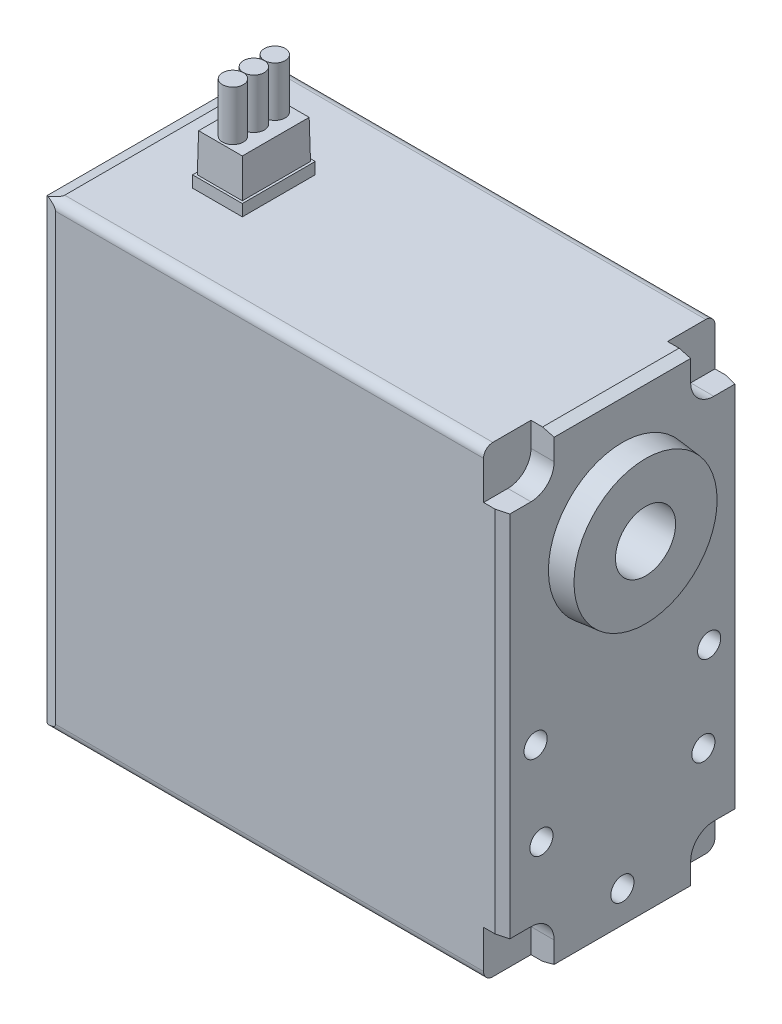
from build123d import *
from OCP.BRepFilletAPI import BRepFilletAPI_MakeChamfer

# Parameters (mm, degrees)
SKETCH_1_W            = 40
SKETCH_1_H            = 20
EXTRUDE_1_DEPTH       = 20
SKETCH_4_R            = 6.5
EXTRUDE_2_DEPTH       = 2
CHAMFER_1_SIZE        = 3
CHAMFER_1_SIZE_2      = 0.315312706
SKETCH_5_R            = 6.5
EXTRUDE_3_DEPTH       = 2
CHAMFER_3_SIZE        = 3
CHAMFER_3_SIZE_2      = 0.315312706
SKETCH_7_R            = 2.6
CUT_EXTRUDE_1_DEPTH   = 10
SKETCH_8_R            = 3
EXTRUDE_4_DEPTH       = 4
SKETCH_8_5_R          = 3.45
SKETCH_8_5_R_2        = 3
EXTRUDE_5_DEPTH       = 0.2
SKETCH_8_6_R          = 3.75
SKETCH_8_6_R_2        = 3.45
EXTRUDE_6_DEPTH       = 0.1
SKETCH_9_R            = 1.5
CUT_EXTRUDE_2_DEPTH   = 5
CHAMFER_4_SIZE        = 1
CHAMFER_4_SIZE2       = 0.267949192
CHAMFER_5_SIZE        = 1
CHAMFER_5_SIZE2       = 0.267949192
FILLET_2_R            = 0.8
SKETCH_10_W           = 4.3
SKETCH_10_H           = 6.3
EXTRUDE_7_DEPTH       = 1
SKETCH_10_3_W         = 3.9
SKETCH_10_3_H         = 5.9
EXTRUDE_8_DEPTH       = 4.3
CHAMFER_6_SIZE        = 3.5
CHAMFER_6_SIZE_2      = 0.061092727
SKETCH_11_R           = 0.9
EXTRUDE_10_DEPTH      = 4.3
SKETCH_12_R           = 1
CUT_EXTRUDE_3_DEPTH   = 4
CUT_EXTRUDE_START     = -4
SKETCH_13_R           = 1
CUT_EXTRUDE_4_DEPTH   = 4
CUT_EXTRUDE_5_DEPTH   = 2
MIRROR_3_COPY_1_DEPTH = 2
SKETCH_15_R           = 1
CUT_EXTRUDE_7_DEPTH   = 4


with BuildPart() as part:
    # 草图1 → 凸台-拉伸1 (new, symmetric)
    with BuildSketch(Plane(origin=(0, 0, 0), x_dir=(1, 0, 0), z_dir=(0, 1, 0))):
        Rectangle(SKETCH_1_W, SKETCH_1_H)
    extrude(amount=EXTRUDE_1_DEPTH, both=True)

    # 草图4 → 凸台-拉伸2 (add)
    with BuildSketch(Plane.ZY.offset(20)):
        with Locations(Location((0, 10, 0), (0, 0, 180))):
            Circle(SKETCH_4_R)
    extrude(amount=EXTRUDE_2_DEPTH)

    # 倒角1
    # the kernel refuses this chamfer: 3, 0.315312706 mm, written as the material it takes off along each edge
    with BuildSketch(Plane(origin=(-22, 10, 0), x_dir=(0, 0, -1), z_dir=(0, 1, 0))) as chamfer_1_piece_1_section:
        Polygon((6.5, -CHAMFER_1_SIZE), (6.5 - CHAMFER_1_SIZE_2, 0), (6.5, 0), align=None)
    chamfer_1_piece_1 = revolve(axis=Axis((-22, 10, 0), (-1, 0, 0)), mode=Mode.PRIVATE)
    chamfer_1_piece_1 = split(chamfer_1_piece_1, bisect_by=Plane(origin=(-20, 10, 6.31172405), z_dir=(-1, 0, 0)), keep=Keep.TOP, mode=Mode.PRIVATE)
    add(chamfer_1_piece_1, mode=Mode.SUBTRACT)

    # 草图5 → 凸台-拉伸3 (add)
    with BuildSketch(Plane(origin=(20, 0, 0), x_dir=(0, 0, -1), z_dir=(1, 0, 0))):
        with Locations(Location((0, 10, 0), (0, 0, 180))):
            Circle(SKETCH_5_R)
    extrude(amount=EXTRUDE_3_DEPTH)

    # 倒角3
    # the kernel refuses this chamfer: 3, 0.315312706 mm, written as the material it takes off along each edge
    with BuildSketch(Plane(origin=(22, 10, 0), x_dir=(0, 0, 1), z_dir=(0, 1, 0))) as chamfer_3_piece_1_section:
        Polygon((6.5, -CHAMFER_3_SIZE), (6.5 - CHAMFER_3_SIZE_2, 0), (6.5, 0), align=None)
    chamfer_3_piece_1 = revolve(axis=Axis((22, 10, 0), (1, 0, 0)), mode=Mode.PRIVATE)
    chamfer_3_piece_1 = split(chamfer_3_piece_1, bisect_by=Plane(origin=(20, 10, -6.31172405), z_dir=(1, 0, 0)), keep=Keep.TOP, mode=Mode.PRIVATE)
    add(chamfer_3_piece_1, mode=Mode.SUBTRACT)

    # 草图7 → 切除-拉伸1 (cut)
    with BuildSketch(Plane(origin=(22, 0, 0), x_dir=(0, 0, -1), z_dir=(1, 0, 0))):
        with Locations((0, 10)):
            Circle(SKETCH_7_R)
    extrude(amount=-CUT_EXTRUDE_1_DEPTH, mode=Mode.SUBTRACT)

    # 草图8 → 凸台-拉伸4 (add)
    with BuildSketch(Plane.ZY.offset(22)):
        with Locations((0, 10)):
            Circle(SKETCH_8_R)
    extrude(amount=EXTRUDE_4_DEPTH)

    # 草图8<5> → 凸台-拉伸5 (add)
    with BuildSketch(Plane.ZY.offset(22)):
        with Locations((0, 10)):
            Circle(SKETCH_8_5_R)
        with Locations((0, 10)):
            Circle(SKETCH_8_5_R_2, mode=Mode.SUBTRACT)
    extrude(amount=EXTRUDE_5_DEPTH)

    # 草图8<6> → 凸台-拉伸6 (add)
    with BuildSketch(Plane.ZY.offset(22)):
        with Locations((0, 10)):
            Circle(SKETCH_8_6_R)
        with Locations((0, 10)):
            Circle(SKETCH_8_6_R_2, mode=Mode.SUBTRACT)
    extrude(amount=EXTRUDE_6_DEPTH)

    # 草图9 → 切除-拉伸2 (cut)
    with BuildSketch(Plane.ZY.offset(26)):
        with Locations((0, 10)):
            Circle(SKETCH_9_R)
    extrude(amount=-CUT_EXTRUDE_2_DEPTH, mode=Mode.SUBTRACT)

    # 倒角4: one chamfer whose edges measure the first distance from different faces: ONE call of the kernel's chamfer builder (chamfer() names one face for all edges)
    chamfer_4_edges_1 = [part.edges().sort_by_distance(p)[0] for p in [
        (20, 20, 0),
    ]]
    chamfer_4_side_1 = [part.faces().sort_by_distance(p)[0] for p in [
        (0, 20, 0),
    ]]
    chamfer_4_edges_2 = [part.edges().sort_by_distance(p)[0] for p in [
        (20, -20, 0),
    ]]
    chamfer_4_side_2 = [part.faces().sort_by_distance(p)[0] for p in [
        (0, -20, 0),
    ]]
    chamfer_4_edges_3 = [part.edges().sort_by_distance(p)[0] for p in [
        (20, 0, 10),
    ]]
    chamfer_4_side_3 = [part.faces().sort_by_distance(p)[0] for p in [
        (0, 0, 10),
    ]]
    chamfer_4_edges_4 = [part.edges().sort_by_distance(p)[0] for p in [
        (20, 0, -10),
    ]]
    chamfer_4_side_4 = [part.faces().sort_by_distance(p)[0] for p in [
        (0, 0, -10),
    ]]
    chamfer_4 = BRepFilletAPI_MakeChamfer(part.part.solid().wrapped)
    for e in chamfer_4_edges_1:
        chamfer_4.Add(CHAMFER_4_SIZE, CHAMFER_4_SIZE2, e.wrapped, chamfer_4_side_1[0].wrapped)  # the first distance lies on this face
    for e in chamfer_4_edges_2:
        chamfer_4.Add(CHAMFER_4_SIZE, CHAMFER_4_SIZE2, e.wrapped, chamfer_4_side_2[0].wrapped)  # the first distance lies on this face
    for e in chamfer_4_edges_3:
        chamfer_4.Add(CHAMFER_4_SIZE, CHAMFER_4_SIZE2, e.wrapped, chamfer_4_side_3[0].wrapped)  # the first distance lies on this face
    for e in chamfer_4_edges_4:
        chamfer_4.Add(CHAMFER_4_SIZE, CHAMFER_4_SIZE2, e.wrapped, chamfer_4_side_4[0].wrapped)  # the first distance lies on this face
    add(Compound.cast(chamfer_4.Shape()), mode=Mode.REPLACE)

    # 倒角5: one chamfer whose edges measure the first distance from different faces: ONE call of the kernel's chamfer builder (chamfer() names one face for all edges)
    chamfer_5_edges_1 = [part.edges().sort_by_distance(p)[0] for p in [
        (-20, 20, 0),
    ]]
    chamfer_5_side_1 = [part.faces().sort_by_distance(p)[0] for p in [
        (-0.5, 20, 0),
    ]]
    chamfer_5_edges_2 = [part.edges().sort_by_distance(p)[0] for p in [
        (-20, -20, 0),
    ]]
    chamfer_5_side_2 = [part.faces().sort_by_distance(p)[0] for p in [
        (-0.5, -20, 0),
    ]]
    chamfer_5_edges_3 = [part.edges().sort_by_distance(p)[0] for p in [
        (-20, 0, 10),
    ]]
    chamfer_5_side_3 = [part.faces().sort_by_distance(p)[0] for p in [
        (-0.5, 0, 10),
    ]]
    chamfer_5_edges_4 = [part.edges().sort_by_distance(p)[0] for p in [
        (-20, 0, -10),
    ]]
    chamfer_5_side_4 = [part.faces().sort_by_distance(p)[0] for p in [
        (-0.5, 0, -10),
    ]]
    chamfer_5 = BRepFilletAPI_MakeChamfer(part.part.solid().wrapped)
    for e in chamfer_5_edges_1:
        chamfer_5.Add(CHAMFER_5_SIZE, CHAMFER_5_SIZE2, e.wrapped, chamfer_5_side_1[0].wrapped)  # the first distance lies on this face
    for e in chamfer_5_edges_2:
        chamfer_5.Add(CHAMFER_5_SIZE, CHAMFER_5_SIZE2, e.wrapped, chamfer_5_side_2[0].wrapped)  # the first distance lies on this face
    for e in chamfer_5_edges_3:
        chamfer_5.Add(CHAMFER_5_SIZE, CHAMFER_5_SIZE2, e.wrapped, chamfer_5_side_3[0].wrapped)  # the first distance lies on this face
    for e in chamfer_5_edges_4:
        chamfer_5.Add(CHAMFER_5_SIZE, CHAMFER_5_SIZE2, e.wrapped, chamfer_5_side_4[0].wrapped)  # the first distance lies on this face
    add(Compound.cast(chamfer_5.Shape()), mode=Mode.REPLACE)

    # 圆角2
    fillet_2_edges = [part.edges().sort_by_distance(p)[0] for p in [
        (0, -20, -10),
        (0, 20, -10),
        (0, -20, 10),
        (0, 20, 10),
    ]]
    fillet(fillet_2_edges, radius=FILLET_2_R)

    # 草图10 → 凸台-拉伸7 (add)
    with BuildSketch(Plane(origin=(0, 20, 0), x_dir=(1, 0, 0), z_dir=(0, 1, 0))):
        with Locations((-11.85, 0)):
            Rectangle(SKETCH_10_W, SKETCH_10_H)
    extrude(amount=EXTRUDE_7_DEPTH)

    # 草图10<3> → 凸台-拉伸8 (add)
    with BuildSketch(Plane(origin=(0, 20, 0), x_dir=(1, 0, 0), z_dir=(0, 1, 0))):
        with Locations((-11.85, 0)):
            Rectangle(SKETCH_10_3_W, SKETCH_10_3_H)
    extrude(amount=EXTRUDE_8_DEPTH)

    # 倒角6
    # the kernel refuses this chamfer: 3.5, 0.061092727 mm, written as the material it takes off along each edge
    with BuildSketch(Plane(origin=(-9.9, 24.3, -12.049948743), x_dir=(0.0006712501823119154, -0.999999774711571, 0), z_dir=(0, 0, 1))) as chamfer_6_piece_1_section:
        Polygon((CHAMFER_6_SIZE * 0.999999774712, -CHAMFER_6_SIZE * 0.000671250182312), (-CHAMFER_6_SIZE_2 * 0.000671250185045, -CHAMFER_6_SIZE_2 * 0.999999778783), (0, 0), align=None)
    chamfer_6_piece_1 = extrude(amount=24.099897487, mode=Mode.PRIVATE)
    chamfer_6_piece_1 = split(chamfer_6_piece_1, bisect_by=Plane(origin=(-9.882223513, 21, 0), z_dir=(0, 1, 0)), keep=Keep.TOP, mode=Mode.PRIVATE)
    add(chamfer_6_piece_1, mode=Mode.SUBTRACT)
    with BuildSketch(Plane(origin=(-22.899948743, 24.3, -2.95), x_dir=(0, -0.999999774711571, -0.0006712501823120375), z_dir=(1, 0, 0))) as chamfer_6_piece_2_section:
        Polygon((CHAMFER_6_SIZE * 0.999999774712, -CHAMFER_6_SIZE * 0.000671250182312), (-CHAMFER_6_SIZE_2 * 0.000671250185045, -CHAMFER_6_SIZE_2 * 0.999999778783), (0, 0), align=None)
    chamfer_6_piece_2 = extrude(amount=22.099897487, mode=Mode.PRIVATE)
    chamfer_6_piece_2 = split(chamfer_6_piece_2, bisect_by=Plane(origin=(-11.85, 21, -2.967776487), z_dir=(0, 1, 0)), keep=Keep.TOP, mode=Mode.PRIVATE)
    add(chamfer_6_piece_2, mode=Mode.SUBTRACT)
    with BuildSketch(Plane(origin=(-13.8, 24.3, 12.049948743), x_dir=(-0.0006712501823119154, -0.999999774711571, 0), z_dir=(0, 0, -1))) as chamfer_6_piece_3_section:
        Polygon((CHAMFER_6_SIZE * 0.999999774712, -CHAMFER_6_SIZE * 0.000671250182312), (-CHAMFER_6_SIZE_2 * 0.000671250185045, -CHAMFER_6_SIZE_2 * 0.999999778783), (0, 0), align=None)
    chamfer_6_piece_3 = extrude(amount=24.099897487, mode=Mode.PRIVATE)
    chamfer_6_piece_3 = split(chamfer_6_piece_3, bisect_by=Plane(origin=(-13.817776487, 21, 0), z_dir=(0, 1, 0)), keep=Keep.TOP, mode=Mode.PRIVATE)
    add(chamfer_6_piece_3, mode=Mode.SUBTRACT)
    with BuildSketch(Plane(origin=(-0.800051257, 24.3, 2.95), x_dir=(0, -0.999999774711571, 0.0006712501823120375), z_dir=(-1, 0, 0))) as chamfer_6_piece_4_section:
        Polygon((CHAMFER_6_SIZE * 0.999999774712, -CHAMFER_6_SIZE * 0.000671250182312), (-CHAMFER_6_SIZE_2 * 0.000671250185045, -CHAMFER_6_SIZE_2 * 0.999999778783), (0, 0), align=None)
    chamfer_6_piece_4 = extrude(amount=22.099897487, mode=Mode.PRIVATE)
    chamfer_6_piece_4 = split(chamfer_6_piece_4, bisect_by=Plane(origin=(-11.85, 21, 2.967776487), z_dir=(0, 1, 0)), keep=Keep.TOP, mode=Mode.PRIVATE)
    add(chamfer_6_piece_4, mode=Mode.SUBTRACT)

    # 草图11 → 凸台-拉伸10 (add)
    with BuildSketch(Plane(origin=(0, 24.3, 0), x_dir=(1, 0, 0), z_dir=(0, 1, 0))):
        with Locations(Location((-11.85, 0, 0), (0, 0, 90))):
            Circle(SKETCH_11_R)
        with Locations(Location((-11.85, 1.81, 0), (0, 0, 90))):
            Circle(SKETCH_11_R)
        with Locations(Location((-11.85, -1.81, 0), (0, 0, 90))):
            Circle(SKETCH_11_R)
    extrude(amount=EXTRUDE_10_DEPTH)

    # 草图12 → 切除-拉伸3 (cut)
    with BuildSketch(Plane(origin=(20, 0, 0), x_dir=(0, 0, -1), z_dir=(1, 0, 0))):
        with Locations((-7.5, -2.5)):
            Circle(SKETCH_12_R)
        with Locations(Location((7.5, -2.5, 0), (0, 0, 180))):
            Circle(SKETCH_12_R)
    extrude(amount=-CUT_EXTRUDE_3_DEPTH, mode=Mode.SUBTRACT)

    # 草图13 → 切除-拉伸4 (cut)
    with BuildSketch(Plane.ZY.offset(20).offset(CUT_EXTRUDE_START)):
        with Locations((-7.5, -17.5)):
            Circle(SKETCH_13_R)
        with Locations(Location((7.5, -17.5, 0), (0, 0, 180))):
            Circle(SKETCH_13_R)
        with Locations((-7.5, -2.5)):
            Circle(SKETCH_13_R)
        with Locations((-7.5, 17.5)):
            Circle(SKETCH_13_R)
        with Locations(Location((7.5, 17.5, 0), (0, 0, 180))):
            Circle(SKETCH_13_R)
        with Locations(Location((7.5, -2.5, 0), (0, 0, 180))):
            Circle(SKETCH_13_R)
    extrude(amount=CUT_EXTRUDE_4_DEPTH, mode=Mode.SUBTRACT)

    # 草图14 → 切除-拉伸5 (cut)
    with BuildSketch(Plane(origin=(20, 0, 0), x_dir=(0, 0, -1), z_dir=(1, 0, 0))):
        with BuildLine():
            ThreePointArc((-9.732050808, 17.097759488), (-8.994421988, 16.2260106), (-7.9, 15.9))
            ThreePointArc((-7.9, 15.9), (-6.485786438, 16.485786438), (-5.9, 17.9))
            ThreePointArc((-5.9, 17.9), (-6.2260106, 18.994421988), (-7.097759488, 19.732050808))
            Line((-7.097759488, 19.732050808), (-8.702240512, 19.732050808))
            ThreePointArc((-8.702240512, 19.732050808), (-9.314213562, 19.314213562), (-9.732050808, 18.702240512))
            Line((-9.732050808, 18.702240512), (-9.732050808, 17.097759488))
        make_face()
        with BuildLine():
            Line((-9.732050808, 19.732050808), (-9.732050808, 18.702240512))
            ThreePointArc((-9.732050808, 18.702240512), (-9.314213562, 19.314213562), (-8.702240512, 19.732050808))
            Line((-8.702240512, 19.732050808), (-9.732050808, 19.732050808))
        make_face()
        with BuildLine():
            ThreePointArc((-7.097759488, 19.732050808), (-6.2260106, 18.994421988), (-5.9, 17.9))
            Line((-5.9, 17.9), (-5.9, 19.732050808))
            Line((-5.9, 19.732050808), (-7.097759488, 19.732050808))
        make_face()
        with BuildLine():
            Line((-8.702240512, 19.732050808), (-7.097759488, 19.732050808))
            ThreePointArc((-7.097759488, 19.732050808), (-7.9, 19.9), (-8.702240512, 19.732050808))
        make_face()
        with BuildLine():
            Line((-10, 15.9), (-9.732050808, 15.9))
            Line((-9.732050808, 15.9), (-9.732050808, 17.097759488))
            ThreePointArc((-9.732050808, 17.097759488), (-9.9, 17.9), (-9.732050808, 18.702240512))
            Line((-9.732050808, 18.702240512), (-9.732050808, 19.732050808))
            Line((-9.732050808, 19.732050808), (-8.702240512, 19.732050808))
            ThreePointArc((-8.702240512, 19.732050808), (-7.9, 19.9), (-7.097759488, 19.732050808))
            Line((-7.097759488, 19.732050808), (-5.9, 19.732050808))
            Line((-5.9, 19.732050808), (-5.9, 20))
            Line((-5.9, 20), (-10, 20))
            Line((-10, 20), (-10, 15.9))
        make_face()
        with BuildLine():
            ThreePointArc((-9.732050808, 18.702240512), (-9.9, 17.9), (-9.732050808, 17.097759488))
            Line((-9.732050808, 17.097759488), (-9.732050808, 18.702240512))
        make_face()
        with BuildLine():
            Line((-9.732050808, 15.9), (-7.9, 15.9))
            ThreePointArc((-7.9, 15.9), (-8.994421988, 16.2260106), (-9.732050808, 17.097759488))
            Line((-9.732050808, 17.097759488), (-9.732050808, 15.9))
        make_face()
    cut_extrude_5 = extrude(amount=-CUT_EXTRUDE_5_DEPTH, mode=Mode.SUBTRACT)

    # 镜向2: 切除-拉伸5 across plane
    add(cut_extrude_5.mirror(Plane.ZX), mode=Mode.SUBTRACT)

    # 镜向3: 切除-拉伸5 across plane
    add(cut_extrude_5.mirror(Plane.XY), mode=Mode.SUBTRACT)

    # 镜向3 copy 1 sketch → 镜向3 copy 1 (cut)
    with BuildSketch(Plane(origin=(20, 0, 0), x_dir=(0, 0, 1), z_dir=(1, 0, 0))):
        with BuildLine():
            ThreePointArc((-9.732050808, 17.097759488), (-8.994421988, 16.2260106), (-7.9, 15.9))
            ThreePointArc((-7.9, 15.9), (-6.485786438, 16.485786438), (-5.9, 17.9))
            ThreePointArc((-5.9, 17.9), (-6.2260106, 18.994421988), (-7.097759488, 19.732050808))
            Line((-7.097759488, 19.732050808), (-8.702240512, 19.732050808))
            ThreePointArc((-8.702240512, 19.732050808), (-9.314213562, 19.314213562), (-9.732050808, 18.702240512))
            Line((-9.732050808, 18.702240512), (-9.732050808, 17.097759488))
        make_face()
        with BuildLine():
            Line((-9.732050808, 19.732050808), (-9.732050808, 18.702240512))
            ThreePointArc((-9.732050808, 18.702240512), (-9.314213562, 19.314213562), (-8.702240512, 19.732050808))
            Line((-8.702240512, 19.732050808), (-9.732050808, 19.732050808))
        make_face()
        with BuildLine():
            ThreePointArc((-7.097759488, 19.732050808), (-6.2260106, 18.994421988), (-5.9, 17.9))
            Line((-5.9, 17.9), (-5.9, 19.732050808))
            Line((-5.9, 19.732050808), (-7.097759488, 19.732050808))
        make_face()
        with BuildLine():
            Line((-8.702240512, 19.732050808), (-7.097759488, 19.732050808))
            ThreePointArc((-7.097759488, 19.732050808), (-7.9, 19.9), (-8.702240512, 19.732050808))
        make_face()
        with BuildLine():
            Line((-10, 15.9), (-9.732050808, 15.9))
            Line((-9.732050808, 15.9), (-9.732050808, 17.097759488))
            ThreePointArc((-9.732050808, 17.097759488), (-9.9, 17.9), (-9.732050808, 18.702240512))
            Line((-9.732050808, 18.702240512), (-9.732050808, 19.732050808))
            Line((-9.732050808, 19.732050808), (-8.702240512, 19.732050808))
            ThreePointArc((-8.702240512, 19.732050808), (-7.9, 19.9), (-7.097759488, 19.732050808))
            Line((-7.097759488, 19.732050808), (-5.9, 19.732050808))
            Line((-5.9, 19.732050808), (-5.9, 20))
            Line((-5.9, 20), (-10, 20))
            Line((-10, 20), (-10, 15.9))
        make_face()
        with BuildLine():
            ThreePointArc((-9.732050808, 18.702240512), (-9.9, 17.9), (-9.732050808, 17.097759488))
            Line((-9.732050808, 17.097759488), (-9.732050808, 18.702240512))
        make_face()
        with BuildLine():
            Line((-9.732050808, 15.9), (-7.9, 15.9))
            ThreePointArc((-7.9, 15.9), (-8.994421988, 16.2260106), (-9.732050808, 17.097759488))
            Line((-9.732050808, 17.097759488), (-9.732050808, 15.9))
        make_face()
    extrude(amount=-MIRROR_3_COPY_1_DEPTH, mode=Mode.SUBTRACT)

    # 草图15 → 切除-拉伸7 (cut)
    with BuildSketch(Plane(origin=(20, 0, 0), x_dir=(0, 0, -1), z_dir=(1, 0, 0))):
        with Locations((0, -17)):
            Circle(SKETCH_15_R)
        with Locations((-7, -10)):
            Circle(SKETCH_15_R)
        with Locations((7, -10)):
            Circle(SKETCH_15_R)
    extrude(amount=-CUT_EXTRUDE_7_DEPTH, mode=Mode.SUBTRACT)


solid = part.part
